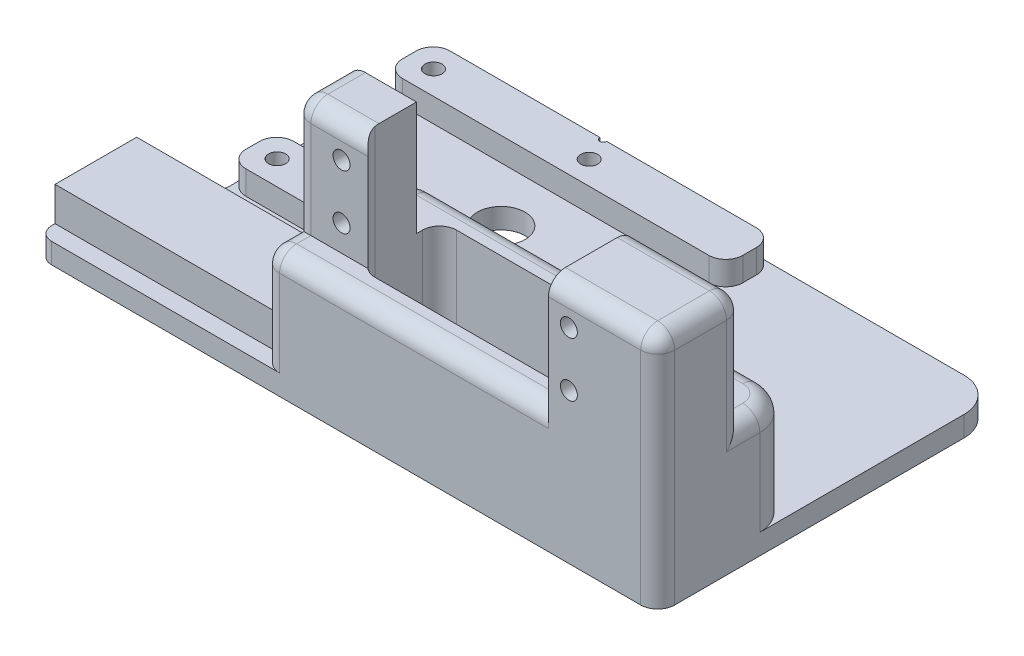
from build123d import *

# Parameters (mm, degrees)
SKETCH1_W             = 83
SKETCH1_H             = 50
BOSS_EXTRUDE1_DEPTH   = 3
SKETCH2_W             = 50
SKETCH2_H             = 7
BOSS_EXTRUDE2_DEPTH   = 3.5
SKETCH3_W             = 16.057447236
SKETCH3_H             = 12.6
SKETCH3_W_2           = 10
BOSS_EXTRUDE3_DEPTH   = 31.93
M3X0_5_TAPPED_HOLE1_D = 2.5
SKETCH6_W             = 58.057447236
SKETCH6_H             = 20
BOSS_EXTRUDE4_DEPTH   = 15.18
SKETCH10_W            = 32
SKETCH10_H            = 12
CUT_EXTRUDE2_DEPTH    = 15.18
CUT_EXTRUDE4_REACH    = 61.727
SKETCH12_W            = 10
SKETCH12_H            = 4.6
SKETCH13_W            = 12
SKETCH13_H            = 8
BOSS_EXTRUDE5_DEPTH   = 33
SKETCH14_W            = 18
SKETCH14_H            = 3
BOSS_EXTRUDE6_DEPTH   = 8.057447236
FILLET1_R             = 5
FILLET2_R             = 5
FILLET3_R             = 2.5
FILLET4_R             = 2.5
FILLET5_R             = 2.5
M3X0_5_TAPPED_HOLE2_D = 2.5
SKETCH9_R             = 3.5
CUT_EXTRUDE1_DEPTH    = 65.034877071
FILLET6_R             = 2.5
CUT_EXTRUDE3_DEPTH    = 66.582356534
FILLET7_R             = 2
M3X0_5_TAPPED_HOLE3_D = 2.5


with BuildPart() as part:
    # Sketch1 → Boss-Extrude1 (new body)
    with BuildSketch(Plane(origin=(0, 0, 0), x_dir=(1, 0, 0), z_dir=(0, 1, 0))):
        Rectangle(SKETCH1_W, SKETCH1_H)
    extrude(amount=BOSS_EXTRUDE1_DEPTH)

    # Sketch2 → Boss-Extrude2 (add)
    with BuildSketch(Plane(origin=(0, 3, 0), x_dir=(1, 0, 0), z_dir=(0, 1, 0))):
        with Locations((-16.5, 21.5)):
            Rectangle(SKETCH2_W, SKETCH2_H)
        with Locations((-16.5, -1.5)):
            Rectangle(SKETCH2_W, SKETCH2_H)
    extrude(amount=BOSS_EXTRUDE2_DEPTH)

    # Sketch3 → Boss-Extrude3 (add)
    with BuildSketch(Plane(origin=(0, 3, 0), x_dir=(1, 0, 0), z_dir=(0, 1, 0))):
        with Locations((33.471276382, -18.7)):
            Rectangle(SKETCH3_W, SKETCH3_H)
        with Locations((-11.557447236, -18.7)):
            Rectangle(SKETCH3_W_2, SKETCH3_H)
    extrude(amount=BOSS_EXTRUDE3_DEPTH)

    # M3x0.5 Tapped Hole1 (through all)
    with Locations(Plane(origin=(0, 0, 12.4), x_dir=(-1, 0, 0), z_dir=(0, 0, -1))):
        with Locations((-28.442552764, 30.03), (-28.442552764, 22.03), (9.557447236, 22.03), (9.557447236, 30.03)):
            Hole(M3X0_5_TAPPED_HOLE1_D / 2)

    # Sketch6 → Boss-Extrude4 (add)
    with BuildSketch(Plane(origin=(0, 3, 0), x_dir=(1, 0, 0), z_dir=(0, 1, 0))):
        with Locations((12.471276382, -15)):
            Rectangle(SKETCH6_W, SKETCH6_H)
    extrude(amount=BOSS_EXTRUDE4_DEPTH)

    # Sketch10 → Cut-Extrude2 (cut)
    with BuildSketch(Plane(origin=(0, 18.18, 0), x_dir=(1, 0, 0), z_dir=(0, 1, 0))):
        with Locations((9.442552764, -15)):
            Rectangle(SKETCH10_W, SKETCH10_H)
    extrude(amount=-CUT_EXTRUDE2_DEPTH, mode=Mode.SUBTRACT)

    # Cut-Extrude4: up to this face of the body (flat: up to its plane)
    cut_extrude4_end = Plane(part.part.faces().sort_by_distance((9.442552764, 18.18, 23))[0])
    # Sketch12 → Cut-Extrude4 (cut, up to the picked face)
    with BuildSketch(Plane(origin=(0, 34.93, 0), x_dir=(1, 0, 0), z_dir=(0, 1, 0)), mode=Mode.PRIVATE) as cut_extrude4_sk1:
        with Locations((-11.557447236, -22.7)):
            Rectangle(SKETCH12_W, SKETCH12_H)
    cut_extrude4_tool1 = split(extrude(cut_extrude4_sk1.sketch, amount=-CUT_EXTRUDE4_REACH, mode=Mode.PRIVATE), bisect_by=cut_extrude4_end, keep=Keep.BOTH, mode=Mode.PRIVATE)
    add(cut_extrude4_tool1.solids().sort_by(Axis((-11.557447, 34.93, 22.7), (0, -1, 0)))[0], mode=Mode.SUBTRACT)

    # Sketch13 → Boss-Extrude5 (add)
    with BuildSketch(Plane.ZY.offset(16.557447236)):
        with Locations((16.5, 4)):
            Rectangle(SKETCH13_W, SKETCH13_H)
    extrude(amount=BOSS_EXTRUDE5_DEPTH)

    # Sketch14 → Boss-Extrude6 (add)
    with BuildSketch(Plane.ZY.offset(41.5)):
        with Locations((16, 1.5)):
            Rectangle(SKETCH14_W, SKETCH14_H)
    extrude(amount=BOSS_EXTRUDE6_DEPTH)

    # Fillet1
    fillet1_edges = [part.edges().sort_by_distance(p)[0] for p in [
        (8.5, 4.75, 5),
        (41.5, 10.59, 5),
        (-16.557447236, 4.75, 5),
    ]]
    fillet(fillet1_edges, radius=FILLET1_R)

    # Fillet2
    fillet2_edges = [part.edges().sort_by_distance(p)[0] for p in [
        (-16.557447236, 12.34, 5),
        (41.5, 1.5, -25),
    ]]
    fillet(fillet2_edges, radius=FILLET2_R)

    # Fillet3
    fillet3_edges = [part.edges().sort_by_distance(p)[0] for p in [
        (8.5, 4.75, -18),
        (-41.5, 4.75, -18),
        (-41.5, 4.75, -2),
        (8.5, 4.75, -2),
        (8.5, 4.75, -25),
        (-41.5, 4.75, 5),
        (-41.5, 3.25, -25),
    ]]
    fillet(fillet3_edges, radius=FILLET3_R)

    # Fillet4
    fillet4_edges = [part.edges().sort_by_distance(p)[0] for p in [
        (41.5, 18.18, 11.2),
        (40.035533906, 18.18, 6.464466094),
        (12.471276382, 18.18, 5),
        (-15.092981142, 18.18, 6.464466094),
        (-16.557447236, 18.18, 11.2),
        (4.442552764, 18.18, 25),
    ]]
    fillet(fillet4_edges, radius=FILLET4_R)

    # Fillet5
    fillet5_edges = [part.edges().sort_by_distance(p)[0] for p in [
        (-16.557447236, 34.93, 16.4),
        (-16.557447236, 26.555, 20.4),
        (-11.557447236, 34.93, 20.4),
        (-16.557447236, 18.18, 21.45),
        (-16.557447236, 9.34, 25),
        (33.471276382, 34.93, 25),
        (33.471276382, 34.93, 12.4),
        (41.5, 25.305, 12.4),
        (41.5, 34.93, 18.7),
        (41.5, 17.465, 25),
        (-16.557447236, 17.447766953, 24.267766953),
    ]]
    fillet(fillet5_edges, radius=FILLET5_R - 0.0001)  # a hair under: the kernel refuses the full size

    # M3x0.5 Tapped Hole2 (through all)
    with Locations(Plane(origin=(0, 6.5, 0), x_dir=(1, 0, 0), z_dir=(0, 1, 0))):
        with Locations((-37.99546971, -1.433732), (-15.066268, -1.49546971), (-15.00453029, 21.433732), (-37.933732, 21.49546971)):
            Hole(M3X0_5_TAPPED_HOLE2_D / 2)

    # Sketch9 → Cut-Extrude1 (cut, through all)
    with BuildSketch(Plane(origin=(0, 3, 0), x_dir=(1, 0, 0), z_dir=(0, 1, 0))):
        with Locations(Location((-16.5, 10, 0), (0, 0, 270))):
            Circle(SKETCH9_R)
    extrude(amount=-CUT_EXTRUDE1_DEPTH, mode=Mode.SUBTRACT)

    # Fillet6
    fillet6_edges = [part.edges().sort_by_distance(p)[0] for p in [
        (-6.557447236, 3, 15),
        (9.442552764, 3, 21),
        (25.442552764, 3, 15),
        (9.442552764, 3, 9),
        (25.442552764, 10.59, 21),
        (25.442552764, 10.59, 9),
        (-6.557447236, 10.59, 21),
        (-6.557447236, 10.59, 9),
    ]]
    fillet(fillet6_edges, radius=FILLET6_R)

    # Sketch11 → Cut-Extrude3 (cut, through all)
    with BuildSketch(Plane.XZ):
        with BuildLine():
            Line((-17, -25), (-16, -25))
            ThreePointArc((-16, -25), (-16.5, -24.5), (-17, -25))
        make_face()
    extrude(amount=-CUT_EXTRUDE3_DEPTH, mode=Mode.SUBTRACT)

    # Fillet7
    fillet7_edges = [part.edges().sort_by_distance(p)[0] for p in [
        (-49.557447236, 1.5, 7),
        (-41.5, 1.5, 7),
        (-49.557447236, 1.5, 25),
    ]]
    fillet(fillet7_edges, radius=FILLET7_R)

    # M3x0.5 Tapped Hole3 (through all)
    with Locations(Plane(origin=(0, 0, 0), x_dir=(-1, 0, 0), z_dir=(0, -1, 0))):
        with Locations((1.5, 10), (31.5, 10)):
            Hole(M3X0_5_TAPPED_HOLE3_D / 2)


solid = part.part
